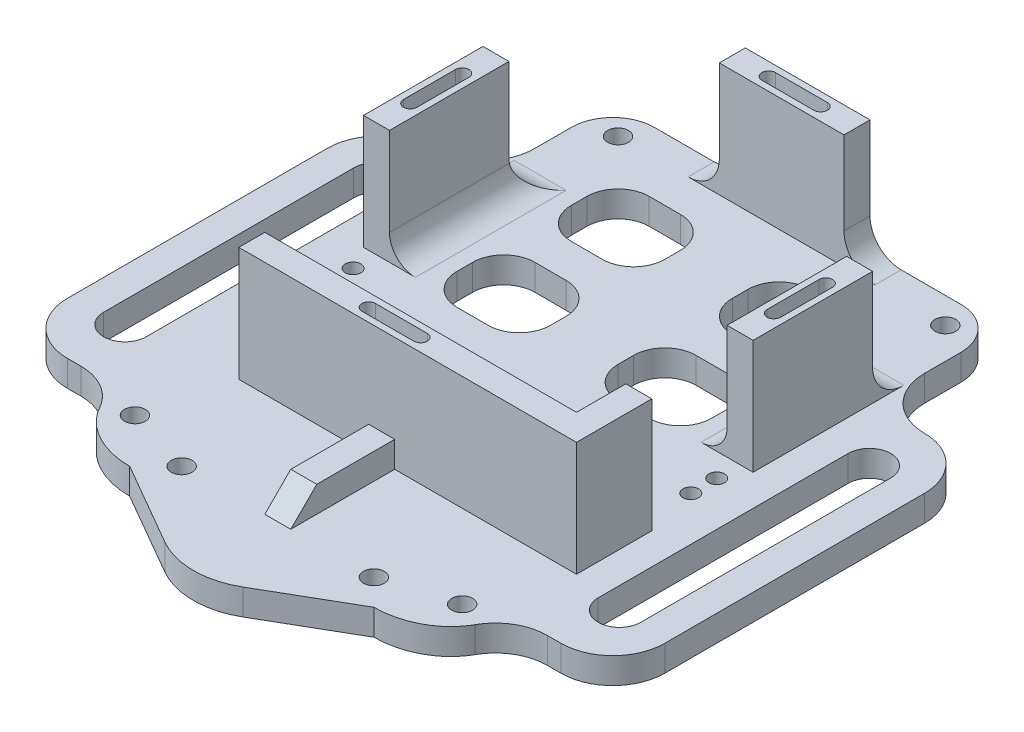
from build123d import *

# Parameters (mm, degrees)
SKETCH_1_W           = 115
SKETCH_1_H           = 70
EXTRUDE_1_DEPTH      = 5
SKETCH_2_R           = 1.5
CUT_EXTRUDE_1_DEPTH  = 5
EXTRUDE_3_DEPTH      = 22
SKETCH_4_W           = 5
SKETCH_4_H           = 23
EXTRUDE_4_DEPTH      = 22
SKETCH_6_W           = 47
SKETCH_6_H           = 27
EXTRUDE_5_DEPTH      = 5
SKETCH_7_R           = 2
CUT_EXTRUDE_3_DEPTH  = 5
CHAMFER_1_SIZE       = 15
CHAMFER_1_SIZE_2     = 25.980762114
RIB_1_REACH          = 116.754
SKETCH_8_WALL_W      = 259.791929252
SKETCH_8_WALL_H      = 5
SKETCH_10_W          = 14.5
SKETCH_10_H          = 22
CUT_EXTRUDE_4_DEPTH  = 10
CUT_EXTRUDE_5_DEPTH  = 5
CUT_EXTRUDE_7_DEPTH  = 5
FILLET_1_R           = 15
EXTRUDE_7_DEPTH      = 5
SKETCH_24_W          = 75
SKETCH_24_H          = 25
EXTRUDE_10_DEPTH     = 5
SKETCH_25_R          = 2
CUT_EXTRUDE_9_DEPTH  = 5
SKETCH_26_W          = 24
SKETCH_26_H          = 5
EXTRUDE_11_DEPTH     = 22
FILLET_6_R           = 8
FILLET_START         = -1
FILLET_7_DEPTH       = 7
FILLET_7_2_DEPTH     = 5
SKETCH_28_W          = 18
SKETCH_28_H          = 15
CUT_EXTRUDE_11_DEPTH = 10
FILLET_8_R           = 6
FILLET_9_R           = 6
CUT_EXTRUDE_12_DEPTH = 10
FILLET_10_R          = 6
FILLET_11_R          = 5
CUT_EXTRUDE_13_DEPTH = 5
CUT_EXTRUDE_14_DEPTH = 5


with BuildPart() as part:
    # 草图1 → 凸台-拉伸1 (new body)
    with BuildSketch(Plane(origin=(0, 0, 0), x_dir=(1, 0, 0), z_dir=(0, 1, 0))):
        with Locations((57.5, -35)):
            Rectangle(SKETCH_1_W, SKETCH_1_H)
    extrude(amount=EXTRUDE_1_DEPTH)

    # 草图2 → 切除-拉伸1 (cut)
    with BuildSketch(Plane(origin=(0, 5, 0), x_dir=(1, 0, 0), z_dir=(0, 1, 0))):
        with Locations(Location((92.5, -27.5, 0), (0, 0, 270))):
            Circle(SKETCH_2_R)
        with Locations(Location((92.5, -32.5, 0), (0, 0, 90))):
            Circle(SKETCH_2_R)
        with Locations(Location((22.5, -32.5, 0), (0, 0, 270))):
            Circle(SKETCH_2_R)
        with Locations(Location((22.5, -27.5, 0), (0, 0, 90))):
            Circle(SKETCH_2_R)
    extrude(amount=-CUT_EXTRUDE_1_DEPTH, mode=Mode.SUBTRACT)

    # 草图3 → 凸台-拉伸3 (add)
    with BuildSketch(Plane(origin=(0, 5, 0), x_dir=(1, 0, 0), z_dir=(0, 1, 0))):
        Polygon((90, -42.5), (95, -42.5), (95, -57), (57.5, -57), (57.5, -52), (90, -52), align=None)
    extrude_3 = extrude(amount=EXTRUDE_3_DEPTH)

    # 镜向1: 凸台-拉伸3 across plane
    add(extrude_3.mirror(Plane(origin=(57.5, 27, 52), x_dir=(0, 0, 1), z_dir=(1, 0, 0))))

    # 草图4 → 凸台-拉伸4 (add)
    with BuildSketch(Plane(origin=(0, 5, 0), x_dir=(1, 0, 0), z_dir=(0, 1, 0))):
        with Locations((92.5, -11.5)):
            Rectangle(SKETCH_4_W, SKETCH_4_H)
    extrude_4 = extrude(amount=EXTRUDE_4_DEPTH)

    # 镜向2: 凸台-拉伸4 across plane
    add(extrude_4.mirror(Plane(origin=(57.5, 0, 0), x_dir=(0, 0, 1), z_dir=(1, 0, 0))))

    # 草图6 → 凸台-拉伸5 (add)
    with BuildSketch(Plane.XZ):
        with Locations((57.5, 83.5)):
            Rectangle(SKETCH_6_W, SKETCH_6_H)
    extrude(amount=-EXTRUDE_5_DEPTH)

    # 草图7 → 切除-拉伸3 (cut)
    with BuildSketch(Plane(origin=(0, 5, 0), x_dir=(1, 0, 0), z_dir=(0, 1, 0))):
        with Locations(Location((39, -77, 0), (0, 0, 270))):
            Circle(SKETCH_7_R)
        with Locations(Location((76, -77, 0), (0, 0, 90))):
            Circle(SKETCH_7_R)
    extrude(amount=-CUT_EXTRUDE_3_DEPTH, mode=Mode.SUBTRACT)

    # 倒角1
    # the kernel refuses this chamfer: 25.980762114, 15 mm, written as the material it takes off along each edge
    with BuildSketch(Plane(origin=(81, -67.214459559, 97), x_dir=(0, 0, -1), z_dir=(0, 1, 0))) as chamfer_1_piece_1:
        Polygon((CHAMFER_1_SIZE, 0), (0, CHAMFER_1_SIZE_2), (0, 0), align=None)
    extrude(amount=139.428919118, mode=Mode.SUBTRACT)
    with BuildSketch(Plane(origin=(34, -67.214459559, 97), x_dir=(1, 0, 0), z_dir=(0, 1, 0))) as chamfer_1_piece_2:
        Polygon((CHAMFER_1_SIZE_2, 0), (0, CHAMFER_1_SIZE), (0, 0), align=None)
    extrude(amount=139.428919118, mode=Mode.SUBTRACT)

    # 草图8 wall → 筋1 (add, up to next)
    with BuildSketch(Plane(origin=(57.5, 15, 67), x_dir=(0, 0.707106781187, -0.707106781187), z_dir=(0, 0.707106781187, 0.707106781187)), mode=Mode.PRIVATE) as rib_1_sk1:
        Rectangle(SKETCH_8_WALL_W, SKETCH_8_WALL_H)
    rib_1_tool1 = extrude(rib_1_sk1.sketch, amount=-RIB_1_REACH, mode=Mode.PRIVATE) - part.part
    add(rib_1_tool1.solids().sort_by_distance((57.5, 15, 67))[0])

    # 草图10 → 切除-拉伸4 (cut)
    with BuildSketch(Plane.ZY.offset(-20)):
        with Locations((49.75, 16)):
            Rectangle(SKETCH_10_W, SKETCH_10_H)
    extrude(amount=-CUT_EXTRUDE_4_DEPTH, mode=Mode.SUBTRACT)

    # 草图11 → 切除-拉伸5 (cut)
    with BuildSketch(Plane(origin=(0, 27, 0), x_dir=(1, 0, 0), z_dir=(0, 1, 0))):
        with BuildLine():
            Line((23.8, -6.5), (23.8, -16.5))
            ThreePointArc((23.8, -16.5), (22.5, -17.8), (21.2, -16.5))
            Line((21.2, -16.5), (21.2, -6.5))
            ThreePointArc((21.2, -6.5), (22.5, -5.2), (23.8, -6.5))
        make_face()
    cut_extrude_5 = extrude(amount=-CUT_EXTRUDE_5_DEPTH, mode=Mode.SUBTRACT)

    # 镜向4: 切除-拉伸5 across plane
    add(cut_extrude_5.mirror(Plane(origin=(57.5, 0, 0), x_dir=(0, 0, 1), z_dir=(1, 0, 0))), mode=Mode.SUBTRACT)

    # 草图15 → 切除-拉伸7 (cut)
    with BuildSketch(Plane.ZY.offset(-55)):
        Polygon((57, 25), (57, 10), (72, 10), align=None)
    extrude(amount=-CUT_EXTRUDE_7_DEPTH, mode=Mode.SUBTRACT)

    # 圆角1
    fillet_1_edges = [part.edges().sort_by_distance(p)[0] for p in [
        (57.5, 2.5, 95.567731326),
    ]]
    fillet(fillet_1_edges, radius=FILLET_1_R)

    # 草图18 → 凸台-拉伸7 (add)
    with BuildSketch(Plane.XZ):
        with BuildLine():
            Line((20, 70), (34, 70))
            Line((34, 70), (34, 82))
            add(Edge.make_bspline(
                [(34, 82), (20, 82), (20, 70)],
                knots=[1.570796327, 1.570796327, 1.570796327, 3.141592654, 3.141592654, 3.141592654], degree=2, weights=[1, 0.707106781, 1]))
        make_face()
    extrude_7 = extrude(amount=-EXTRUDE_7_DEPTH)

    # 镜向8: 凸台-拉伸7 across plane
    add(extrude_7.mirror(Plane(origin=(57.5, 0, 0), x_dir=(0, 0, 1), z_dir=(1, 0, 0))))

    # 草图24 → 凸台-拉伸10 (add)
    with BuildSketch(Plane.XZ):
        with Locations((57.5, -12.5)):
            Rectangle(SKETCH_24_W, SKETCH_24_H)
    extrude(amount=-EXTRUDE_10_DEPTH)

    # 草图25 → 切除-拉伸9 (cut)
    with BuildSketch(Plane(origin=(0, 5, 0), x_dir=(1, 0, 0), z_dir=(0, 1, 0))):
        with Locations(Location((89, -73, 0), (0, 0, 270))):
            Circle(SKETCH_25_R)
        with Locations(Location((89, 20, 0), (0, 0, 270))):
            Circle(SKETCH_25_R)
    cut_extrude_9 = extrude(amount=-CUT_EXTRUDE_9_DEPTH, mode=Mode.SUBTRACT)

    # 镜向11: 切除-拉伸9 across plane
    add(cut_extrude_9.mirror(Plane(origin=(57.5, 0, 0), x_dir=(0, 0, 1), z_dir=(1, 0, 0))), mode=Mode.SUBTRACT)

    # 草图26 → 凸台-拉伸11 (add)
    with BuildSketch(Plane(origin=(0, 5, 0), x_dir=(1, 0, 0), z_dir=(0, 1, 0))):
        with Locations((57.5, 22.5)):
            Rectangle(SKETCH_26_W, SKETCH_26_H)
    extrude(amount=EXTRUDE_11_DEPTH)

    # 圆角6
    fillet_6_edges = [part.edges().sort_by_distance(p)[0] for p in [
        (20, 2.5, -25),
        (95, 2.5, -25),
    ]]
    fillet(fillet_6_edges, radius=FILLET_6_R)

    # 圆角7: read off the stored shape, not the designer's step
    # 圆角7 outline → 圆角7 (cut)
    with BuildSketch(Plane(origin=(0, 0, 0), x_dir=(1, 0, 0), z_dir=(0, 1, 0)).offset(FILLET_START)):
        with BuildLine():
            ThreePointArc((105, 0), (112.071067812, -2.928932188), (115, -10))
            Line((115, -10), (115, 0))
            Line((115, 0), (105, 0))
        make_face()
        with BuildLine():
            ThreePointArc((115, -60), (112.071067812, -67.071067812), (105, -70))
            Line((105, -70), (115, -70))
            Line((115, -70), (115, -60))
        make_face()
        with BuildLine():
            Line((0, 0), (0, -10))
            ThreePointArc((0, -10), (2.928932188, -2.928932188), (10, 0))
            Line((10, 0), (0, 0))
        make_face()
        with BuildLine():
            ThreePointArc((10, -70), (2.928932188, -67.071067812), (0, -60))
            Line((0, -60), (0, -70))
            Line((0, -70), (10, -70))
        make_face()
    extrude(amount=FILLET_7_DEPTH, mode=Mode.SUBTRACT)

    # Fillet 7 2 outline → Fillet 7 2 (add)
    with BuildSketch(Plane(origin=(0, 0, 0), x_dir=(1, 0, 0), z_dir=(0, 1, 0))):
        with BuildLine():
            add(Edge.make_bspline(
                [(93.644655928, -75.150899174), (95, -72.706455982), (95, -70)],
                knots=[5.824972497, 5.824972497, 5.824972497, 6.283185307, 6.283185307, 6.283185307], degree=2, weights=[0.878968224, 0.9145609, 1]))
            ThreePointArc((93.644655928, -75.150899174), (97.315407297, -71.383416911), (102.390296052, -70))
            Line((102.390296052, -70), (95, -70))
        make_face()
        with BuildLine():
            Line((95, 0), (105, 0))
            ThreePointArc((105, 0), (97.928932188, 2.928932188), (95, 10))
            Line((95, 10), (95, 0))
        make_face()
        with BuildLine():
            Line((20, -70), (12.609703948, -70))
            ThreePointArc((12.609703948, -70), (17.684592703, -71.383416911), (21.355344072, -75.150899174))
            add(Edge.make_bspline(
                [(21.355344072, -75.150899174), (20, -72.706455982), (20, -70)],
                knots=[5.824972497, 5.824972497, 5.824972497, 6.283185307, 6.283185307, 6.283185307], degree=2, weights=[0.878968224, 0.9145609, 1]))
        make_face()
        with BuildLine():
            ThreePointArc((20, 10), (17.071067812, 2.928932188), (10, 0))
            Line((10, 0), (20, 0))
            Line((20, 0), (20, 10))
        make_face()
    extrude(amount=FILLET_7_2_DEPTH)

    # 草图28 → 切除-拉伸11 (cut)
    with BuildSketch(Plane(origin=(0, 5, 0), x_dir=(1, 0, 0), z_dir=(0, 1, 0))):
        with Locations((42, 5.5)):
            Rectangle(SKETCH_28_W, SKETCH_28_H)
        with Locations((73, 5.5)):
            Rectangle(SKETCH_28_W, SKETCH_28_H)
        with Locations((73, -16.5)):
            Rectangle(SKETCH_28_W, SKETCH_28_H)
        with Locations((73, -38.5)):
            Rectangle(SKETCH_28_W, SKETCH_28_H)
        with Locations((42, -16.5)):
            Rectangle(SKETCH_28_W, SKETCH_28_H)
        with Locations((42, -38.5)):
            Rectangle(SKETCH_28_W, SKETCH_28_H)
    extrude(amount=-CUT_EXTRUDE_11_DEPTH, mode=Mode.SUBTRACT)

    # 圆角8
    fillet_8_edges = [part.edges().sort_by_distance(p)[0] for p in [
        (82, 2.5, 46),
        (64, 2.5, 46),
        (64, 2.5, 31),
        (82, 2.5, 31),
        (82, 2.5, 24),
        (64, 2.5, 24),
        (64, 2.5, 9),
        (82, 2.5, 9),
        (82, 2.5, 2),
        (64, 2.5, 2),
        (64, 2.5, -13),
        (82, 2.5, -13),
    ]]
    fillet(fillet_8_edges, radius=FILLET_8_R)

    # 圆角9
    fillet_9_edges = [part.edges().sort_by_distance(p)[0] for p in [
        (51, 2.5, 24),
        (33, 2.5, 24),
        (33, 2.5, 9),
        (51, 2.5, 9),
        (51, 2.5, 46),
        (33, 2.5, 46),
        (33, 2.5, 31),
        (51, 2.5, 31),
        (51, 2.5, -13),
        (51, 2.5, 2),
        (33, 2.5, 2),
        (33, 2.5, -13),
    ]]
    fillet(fillet_9_edges, radius=FILLET_9_R)

    # 草图29 → 切除-拉伸12 (cut)
    with BuildSketch(Plane(origin=(0, 5, 0), x_dir=(1, 0, 0), z_dir=(0, 1, 0))):
        with BuildLine():
            Line((109.195843091, -10.700151008), (109.195843091, -58.829338195))
            ThreePointArc((109.195843091, -58.829338195), (105.102845499, -62.922335787), (101.009847907, -58.829338195))
            Line((101.009847907, -58.829338195), (101.009847907, -10.700151008))
            ThreePointArc((101.009847907, -10.700151008), (105.102845499, -6.607153417), (109.195843091, -10.700151008))
        make_face()
    cut_extrude_12 = extrude(amount=-CUT_EXTRUDE_12_DEPTH, mode=Mode.SUBTRACT)

    # 镜向16: 切除-拉伸12 across plane
    add(cut_extrude_12.mirror(Plane(origin=(57.5, 0, 0), x_dir=(0, 0, 1), z_dir=(1, 0, 0))), mode=Mode.SUBTRACT)

    # 圆角10
    fillet_10_edges = [part.edges().sort_by_distance(p)[0] for p in [
        (22.5, 5, 0),
        (92.5, 5, 0),
        (69.5, 5, -22.5),
        (45.5, 5, -22.5),
    ]]
    fillet(fillet_10_edges, radius=FILLET_10_R)

    # 圆角11
    fillet_11_edges = [part.edges().sort_by_distance(p)[0] for p in [
        (90, 5, 47.25),
        (90, 5, 8.5),
        (25, 5, 8.5),
    ]]
    fillet(fillet_11_edges, radius=FILLET_11_R)

    # 草图30 → 切除-拉伸13 (cut)
    with BuildSketch(Plane(origin=(0, 27, 0), x_dir=(1, 0, 0), z_dir=(0, 1, 0))):
        with BuildLine():
            Line((52.5, 23.8), (62.5, 23.8))
            ThreePointArc((62.5, 23.8), (63.8, 22.5), (62.5, 21.2))
            Line((62.5, 21.2), (52.5, 21.2))
            ThreePointArc((52.5, 21.2), (51.2, 22.5), (52.5, 23.8))
        make_face()
    extrude(amount=-CUT_EXTRUDE_13_DEPTH, mode=Mode.SUBTRACT)

    # 草图31 → 切除-拉伸14 (cut)
    with BuildSketch(Plane(origin=(0, 27, 0), x_dir=(1, 0, 0), z_dir=(0, 1, 0))):
        with BuildLine():
            Line((52.5, -53.2), (62.5, -53.2))
            ThreePointArc((62.5, -53.2), (63.8, -54.5), (62.5, -55.8))
            Line((62.5, -55.8), (52.5, -55.8))
            ThreePointArc((52.5, -55.8), (51.2, -54.5), (52.5, -53.2))
        make_face()
    extrude(amount=-CUT_EXTRUDE_14_DEPTH, mode=Mode.SUBTRACT)


solid = part.part
